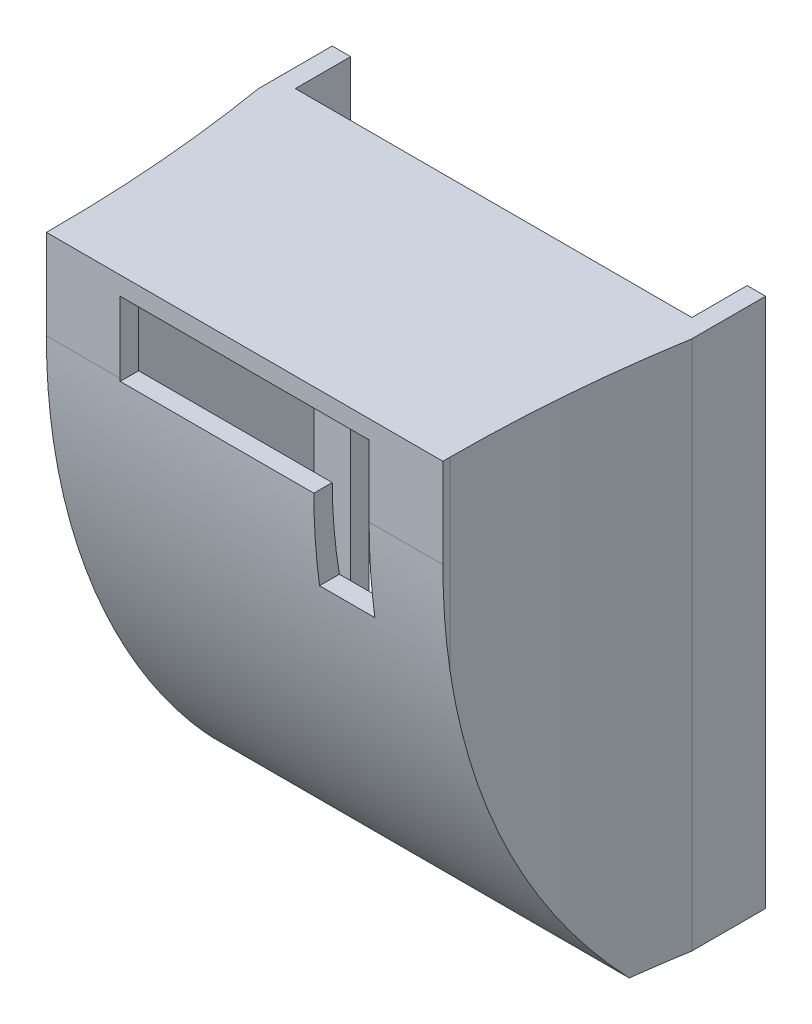
from build123d import *

# Parameters (mm, degrees)
SKETCH1_W           = 21.5
SKETCH1_H           = 28.75
SKETCH1_W_2         = 13.5
SKETCH1_H_2         = 26.75
BOSS_EXTRUDE1_DEPTH = 1
SKETCH3_W           = 21.5
SKETCH3_H           = 12.5
BOSS_EXTRUDE2_DEPTH = 1
BOSS_EXTRUDE3_DEPTH = 2
BOSS_EXTRUDE4_START = -19.5
BOSS_EXTRUDE4_DEPTH = 2
BOSS_EXTRUDE5_REACH = 29.733
CUT_EXTRUDE1_DEPTH  = 23.460033949
SKETCH7_W           = 4
SKETCH7_H           = 28.75
BOSS_EXTRUDE8_DEPTH = 1
BOSS_EXTRUDE9_DEPTH = 0.5
FILLET2_R           = 74


with BuildPart() as part:
    # Sketch1 → Boss-Extrude1 (new body)
    with BuildSketch(Plane.XY):
        Rectangle(SKETCH1_W, SKETCH1_H)
        Rectangle(SKETCH1_W_2, SKETCH1_H_2, mode=Mode.SUBTRACT)
    extrude(amount=BOSS_EXTRUDE1_DEPTH)

    # Sketch3 → Boss-Extrude2 (add)
    with BuildSketch(Plane(origin=(0, 14.375, 0), x_dir=(1, 0, 0), z_dir=(0, 1, 0))):
        with Locations((0, -7.25)):
            Rectangle(SKETCH3_W, SKETCH3_H)
    extrude(amount=-BOSS_EXTRUDE2_DEPTH)

    # Sketch4 → Boss-Extrude3 (add)
    with BuildSketch(Plane(origin=(10.75, 0, 0), x_dir=(0, 0, -1), z_dir=(1, 0, 0))):
        with BuildLine():
            Line((-13.5, 13.375), (-13.5, 9.51786033))
            ThreePointArc((-13.5, 9.51786033), (-11.027421028, -3.345267641), (-3.962103479, -14.375))
            Line((-3.962103479, -14.375), (-1, -14.375))
            Line((-1, -14.375), (-1, 13.375))
            Line((-1, 13.375), (-13.5, 13.375))
        make_face()
    extrude(amount=-BOSS_EXTRUDE3_DEPTH)

    # Sketch4<2> → Boss-Extrude4 (add)
    with BuildSketch(Plane(origin=(10.75, 0, 0), x_dir=(0, 0, -1), z_dir=(1, 0, 0)).offset(BOSS_EXTRUDE4_START)):
        with BuildLine():
            Line((-13.5, 13.375), (-13.5, 9.51786033))
            ThreePointArc((-13.5, 9.51786033), (-11.027421028, -3.345267641), (-3.962103479, -14.375))
            Line((-3.962103479, -14.375), (-1, -14.375))
            Line((-1, -14.375), (-1, 13.375))
            Line((-1, 13.375), (-13.5, 13.375))
        make_face()
    extrude(amount=-BOSS_EXTRUDE4_DEPTH)

    # Sketch5 → Boss-Extrude5 (add, up to next)
    with BuildSketch(Plane.ZY.offset(-8.75), mode=Mode.PRIVATE) as boss_extrude5_sk1:
        with BuildLine():
            Line((12.5, 13.375), (13.5, 13.375))
            Line((13.5, 13.375), (13.5, 9.51786033))
            ThreePointArc((13.5, 9.51786033), (11.027421028, -3.345267641), (3.962103479, -14.375))
            Line((3.962103479, -14.375), (1, -14.375))
            Line((1, -14.375), (1, -13.104031722))
            ThreePointArc((1, -13.104031722), (9.459967949, -3.17071721), (12.5, 9.51786033))
            Line((12.5, 9.51786033), (12.5, 13.375))
        make_face()
    boss_extrude5_tool1 = extrude(boss_extrude5_sk1.sketch, amount=BOSS_EXTRUDE5_REACH, mode=Mode.PRIVATE) - part.part
    add(boss_extrude5_tool1.solids().sort_by_distance((8.75, -14.070646, 2.481052))[0])

    # Sketch6 → Cut-Extrude1 (cut, through all)
    with BuildSketch(Plane(origin=(0, 0, 0), x_dir=(-1, 0, 0), z_dir=(0, 0, -1))):
        Polygon((-6.75, 13.375), (6.75, 13.375), (6.75, 9.375), (-3.75, 9.375), (-3.75, 4.875), (-6.75, 4.875), align=None)
    extrude(amount=-CUT_EXTRUDE1_DEPTH, mode=Mode.SUBTRACT)

    # Sketch7 → Boss-Extrude8 (add)
    with BuildSketch(Plane(origin=(10.75, 0, 0), x_dir=(0, 0, -1), z_dir=(1, 0, 0))):
        with Locations((1, 0)):
            Rectangle(SKETCH7_W, SKETCH7_H)
    boss_extrude8 = extrude(amount=BOSS_EXTRUDE8_DEPTH)

    # Sketch7<5> → Boss-Extrude9 (add)
    with BuildSketch(Plane(origin=(10.75, 0, 0), x_dir=(0, 0, -1), z_dir=(1, 0, 0))):
        with BuildLine():
            Line((3, -10), (3, 10))
            ThreePointArc((3, 10), (2, 11), (1, 10))
            Line((1, 10), (1, -10))
            ThreePointArc((1, -10), (2, -11), (3, -10))
        make_face()
    boss_extrude9 = extrude(amount=-BOSS_EXTRUDE9_DEPTH)

    # Mirror3: Boss-Extrude8, Boss-Extrude9 across plane
    add(boss_extrude8.mirror(Plane(origin=(0, 0, 0), x_dir=(0, 0, 1), z_dir=(1, 0, 0))))
    add(boss_extrude9.mirror(Plane(origin=(0, 0, 0), x_dir=(0, 0, 1), z_dir=(1, 0, 0))))

    # Fillet2
    # the kernel refuses this fillet: 74 mm, written as the material it adds along each edge
    with BuildSketch(Plane(origin=(10.75, -14.375, 1), x_dir=(0, 0, 1), z_dir=(0, 1, 0))) as fillet2_piece_1_section:
        with BuildLine():
            CenterArc((12.124355653, 74), FILLET2_R, 260.569992092, 9.430007908)
            Line((0, 1), (0, 0))
            Line((0, 0), (12.124355653, 0))
        make_face()
    fillet2_piece_1 = extrude(amount=28.75, mode=Mode.PRIVATE)
    fillet2_piece_1 = fillet2_piece_1 & Plane(origin=(10.75, 9.51786033, -21.195293839), x_dir=(0, 0, 1), z_dir=(1, 0, 0)) * Cylinder(34.695293839, 106, mode=Mode.PRIVATE)
    add(fillet2_piece_1)
    with BuildSketch(Plane(origin=(-10.75, -14.375, 1), x_dir=(0, 0, 1), z_dir=(0, 1, 0))) as fillet2_piece_2_section:
        with BuildLine():
            CenterArc((12.124355653, -74), FILLET2_R, 90, 9.430007908)
            Line((0, -1), (0, 0))
            Line((0, 0), (12.124355653, 0))
        make_face()
    fillet2_piece_2 = extrude(amount=28.75, mode=Mode.PRIVATE)
    fillet2_piece_2 = fillet2_piece_2 & Plane(origin=(-10.75, 9.51786033, -21.195293839), x_dir=(0, 0, 1), z_dir=(1, 0, 0)) * Cylinder(34.695293839, 106, mode=Mode.PRIVATE)
    add(fillet2_piece_2)


solid = part.part
